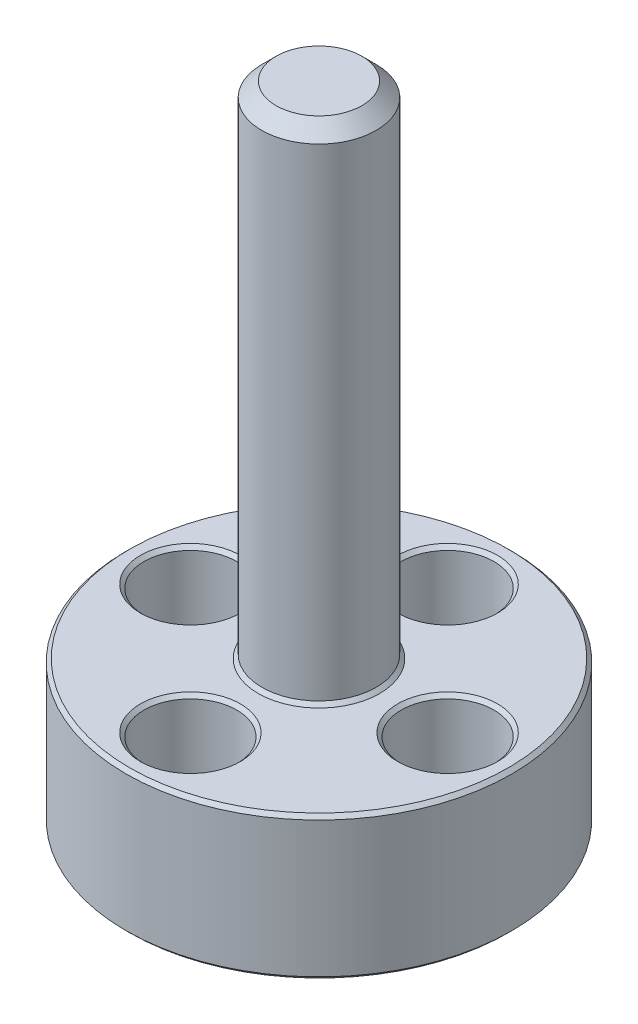
from build123d import *

# Parameters (mm, degrees)
SKETCH2_R                      = 13.5
BOSS_EXTRUDE1_DEPTH            = 10
SKETCH3_R                      = 4
BOSS_EXTRUDE2_DEPTH            = 45
CBORE_FOR_M3_SHCS1_D           = 3.2
CBORE_FOR_M3_SHCS1_CBORE_D     = 6.5
CBORE_FOR_M3_SHCS1_CBORE_DEPTH = 5
SKETCH10_R                     = 2.25
CUT_EXTRUDE3_DEPTH             = 7
CHAMFER1_SIZE                  = 0.25
CHAMFER2_SIZE                  = 1


with BuildPart() as part:
    # Sketch2 → Boss-Extrude1 (new body)
    with BuildSketch(Plane(origin=(0, 0, 0), x_dir=(1, 0, 0), z_dir=(0, 1, 0))):
        Circle(SKETCH2_R)
    extrude(amount=BOSS_EXTRUDE1_DEPTH)

    # Sketch3 → Boss-Extrude2 (add)
    with BuildSketch(Plane(origin=(0, 0, 0), x_dir=(1, 0, 0), z_dir=(0, 1, 0))):
        Circle(SKETCH3_R)
    extrude(amount=BOSS_EXTRUDE2_DEPTH)

    # CBORE for M3 SHCS1 (through all)
    with Locations(Plane(origin=(0, 10, 0), x_dir=(1, 0, 0), z_dir=(0, 1, 0))):
        with Locations((-9, 0), (9, 0), (0, 9), (0, -9)):
            CounterBoreHole(CBORE_FOR_M3_SHCS1_D / 2, CBORE_FOR_M3_SHCS1_CBORE_D / 2, CBORE_FOR_M3_SHCS1_CBORE_DEPTH)

    # Sketch10 → Cut-Extrude3 (cut)
    with BuildSketch(Plane(origin=(0, 0, 0), x_dir=(1, 0, 0), z_dir=(0, 1, 0))):
        Circle(SKETCH10_R)
    extrude(amount=CUT_EXTRUDE3_DEPTH, mode=Mode.SUBTRACT)

    # Chamfer1
    chamfer1_edges = [part.edges().sort_by_distance(p)[0] for p in [
        (-13.5, 0, 0),
        (1.6, 0, 9),
        (10.6, 0, 0),
        (1.6, 0, -9),
        (-7.4, 0, 0),
        (-2.25, 0, 0),
        (-13.5, 10, 0),
        (-4, 10, 0),
        (-3.25, 10, 9),
        (5.75, 10, 0),
        (-3.25, 10, -9),
        (-12.25, 10, 0),
    ]]
    chamfer(chamfer1_edges, length=CHAMFER1_SIZE)

    # Chamfer2
    chamfer2_edges = [part.edges().sort_by_distance(p)[0] for p in [
        (-4, 45, 0),
    ]]
    chamfer(chamfer2_edges, length=CHAMFER2_SIZE)


solid = part.part
